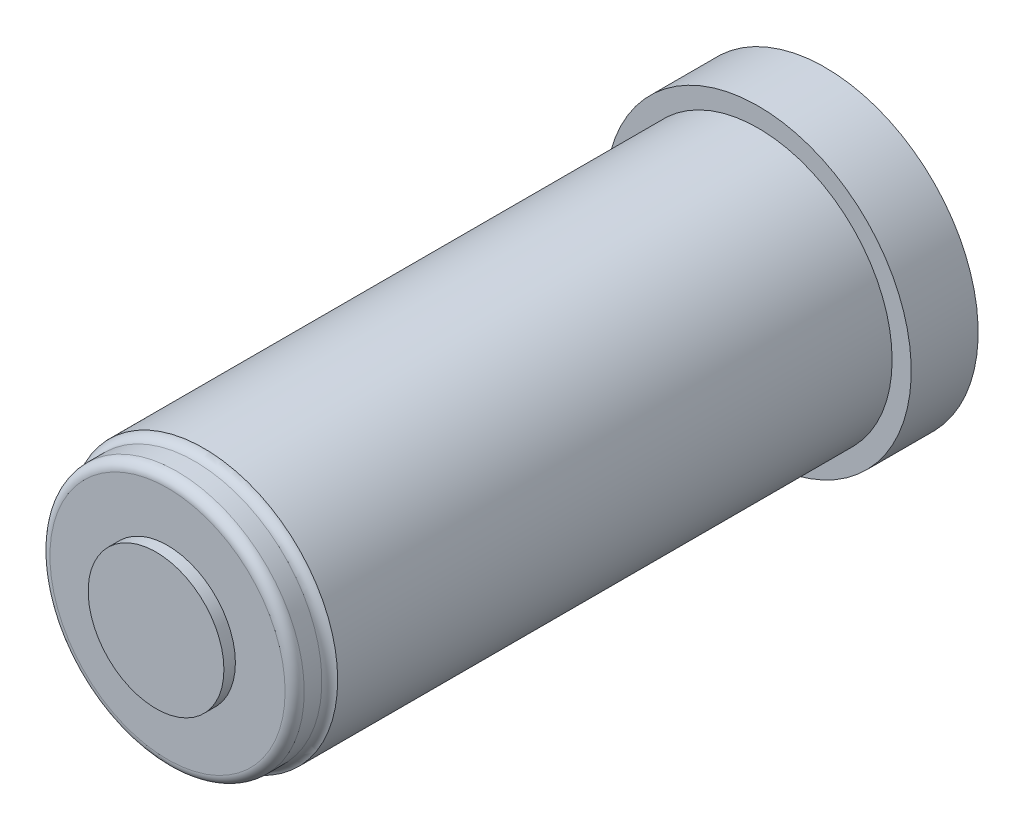
from build123d import *

# Parameters (mm, degrees)
SKETCH1_R           = 140
BOSS_EXTRUDE1_DEPTH = 580
SKETCH2_R           = 133
BOSS_EXTRUDE2_DEPTH = 38
SKETCH3_R           = 71
BOSS_EXTRUDE3_DEPTH = 12
FILLET2_R           = 10
SKETCH4_R           = 160
BOSS_EXTRUDE4_DEPTH = 70
SKETCH5_R           = 68.74
CUT_EXTRUDE1_DEPTH  = 14
FILLET3_R           = 10


with BuildPart() as part:
    # Sketch1 → Boss-Extrude1 (new body)
    with BuildSketch(Plane.XY):
        Circle(SKETCH1_R)
    extrude(amount=-BOSS_EXTRUDE1_DEPTH)

    # Sketch2 → Boss-Extrude2 (add)
    with BuildSketch(Plane.XY):
        Circle(SKETCH2_R)
    extrude(amount=BOSS_EXTRUDE2_DEPTH)

    # Sketch3 → Boss-Extrude3 (add)
    with BuildSketch(Plane.XY.offset(38)):
        Circle(SKETCH3_R)
    extrude(amount=BOSS_EXTRUDE3_DEPTH)

    # Fillet2
    # the kernel refuses this fillet: 10 mm, written as the material it adds along each edge
    with BuildSketch(Plane(origin=(0, 0, 0), x_dir=(1, 0, 0), z_dir=(0, -1, 0))) as fillet2_piece_1:
        with BuildLine():
            CenterArc((143, 9.539392014), FILLET2_R, 180, 72.542396876)
            Line((133, 9.539392014), (133, 0))
            Line((133, 0), (140, 0))
        make_face()
    revolve(axis=Axis((0, 0, 0), (0, 0, 1)))
    # the kernel refuses this fillet: 10 mm, written as the material it takes off along each edge
    with BuildSketch(Plane(origin=(0, 0, 38), x_dir=(1, 0, 0), z_dir=(0, -1, 0))) as fillet2_2_piece_1:
        with BuildLine():
            CenterArc((133 - FILLET2_R, -FILLET2_R), FILLET2_R, 0, 90)
            Line((133 - FILLET2_R, 0), (133, 0))
            Line((133, 0), (133, -FILLET2_R))
        make_face()
    revolve(axis=Axis((0, 0, 38), (0, 0, 1)), mode=Mode.SUBTRACT)

    # Sketch4 → Boss-Extrude4 (add)
    with BuildSketch(Plane(origin=(0, 0, -580), x_dir=(-1, 0, 0), z_dir=(0, 0, -1))):
        Circle(SKETCH4_R)
    extrude(amount=BOSS_EXTRUDE4_DEPTH)

    # Sketch5 → Cut-Extrude1 (cut)
    with BuildSketch(Plane(origin=(0, 0, -650), x_dir=(-1, 0, 0), z_dir=(0, 0, -1))):
        Circle(SKETCH5_R)
    extrude(amount=-CUT_EXTRUDE1_DEPTH, mode=Mode.SUBTRACT)

    # Fillet3
    fillet3_edges = [part.edges().sort_by_distance(p)[0] for p in [
        (68.74, 0, -650),
    ]]
    fillet(fillet3_edges, radius=FILLET3_R)


solid = part.part
